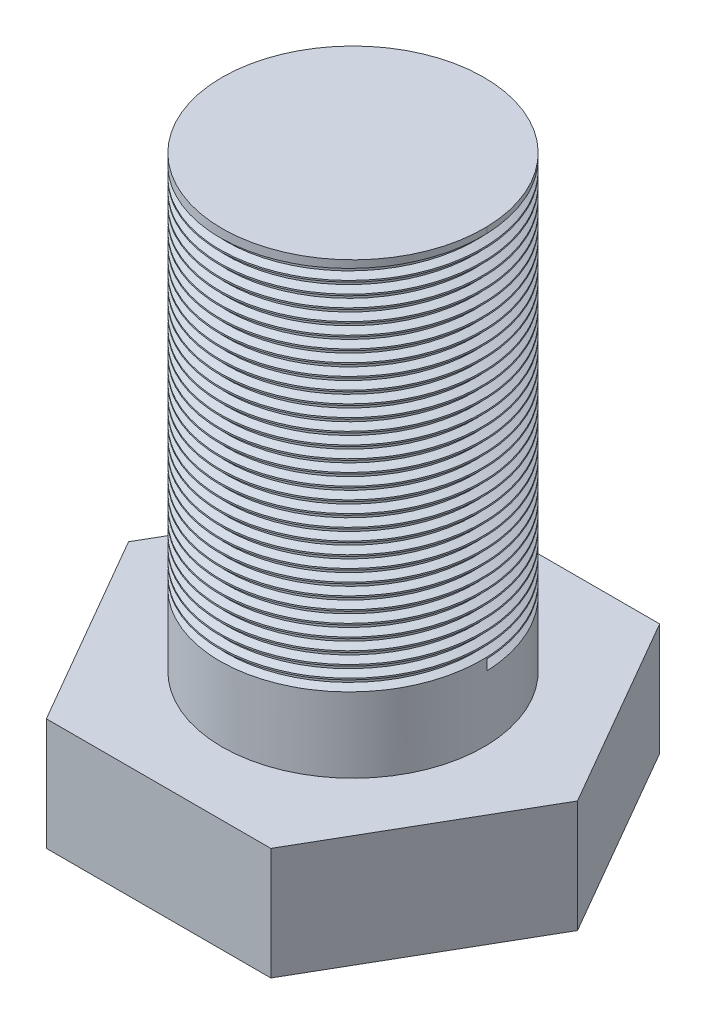
from build123d import *

# Parameters (mm, degrees)
BOSS_EXTRUDE1_DEPTH = 3
SKETCH2_R           = 3.5
BOSS_EXTRUDE2_DEPTH = 12
THREAD1_PITCH       = 0.3175


with BuildPart() as part:
    # Sketch1 → Boss-Extrude1 (new body)
    with BuildSketch(Plane(origin=(0, 0, 0), x_dir=(1, 0, 0), z_dir=(0, 1, 0))):
        Polygon((3, -5.196152423), (6, 0), (3, 5.196152423), (-3, 5.196152423), (-6, 0), (-3, -5.196152423), align=None)
    extrude(amount=BOSS_EXTRUDE1_DEPTH)

    # Sketch2 → Boss-Extrude2 (add)
    with BuildSketch(Plane(origin=(0, 3, 0), x_dir=(1, 0, 0), z_dir=(0, 1, 0))):
        with Locations(Location((0, 0, 0), (0, 0, 270))):
            Circle(SKETCH2_R)
    extrude(amount=BOSS_EXTRUDE2_DEPTH)

    # Thread1: the profile of Thread Profile1 profile screwed along a right-hand helix of 31.496063 turns, 6 arcs to a turn; built about Z, then put on its axis
    thread1_z = Axis((0, 0, 0), (0, 0, 1))
    thread1_corners = [(3.5003, 0, -0.000173205), (3.5003, 0, 0.277985704), (3.328148085, 0, 0.17859375), (3.328148085, 0, 0.09921875)]
    with BuildLine(mode=Mode.PRIVATE) as thread1_profile:
        Line(thread1_corners[0], thread1_corners[1])
        Line(thread1_corners[1], thread1_corners[2])
        Line(thread1_corners[2], thread1_corners[3])
        Line(thread1_corners[3], thread1_corners[0])
    thread1_cap = Face(thread1_profile.wire())
    thread1_turn_angles = [0, 30, 60, 90, 120, 150, 180, 210, 240, 270, 300, 330, 360]
    thread1_turn_weights = [1, 0.8660254037844387, 1, 0.8660254037844387, 1, 0.8660254037844387, 1, 0.8660254037844387, 1, 0.8660254037844387, 1, 0.8660254037844387, 1]
    thread1_turn_rails = [Edge.make_bspline([Vector(p[0], p[1], 0).rotate(thread1_z, thread1_turn_angles[k]) / thread1_turn_weights[k] + Vector(0, 0, p[2] + THREAD1_PITCH * thread1_turn_angles[k] / 360) for k in range(13)], [0, 0, 0, 1, 1, 2, 2, 3, 3, 4, 4, 5, 5, 6, 6, 6], 2, thread1_turn_weights) for p in thread1_corners]
    thread1_turn_sides = [Face.make_surface_from_curves(thread1_turn_rails[p[0]], thread1_turn_rails[p[1]]) for p in [(0, 1), (1, 2), (2, 3), (3, 0)]]
    thread1_last_angles = [11160, 11190, 11220, 11250, 11280, 11309.291338583, 11338.582677165]
    thread1_last_weights = [1, 0.8660254037844387, 1, 0.8660254037844387, 1, 0.872143242535045, 1]
    thread1_last_rails = [Edge.make_bspline([Vector(p[0], p[1], 0).rotate(thread1_z, thread1_last_angles[k]) / thread1_last_weights[k] + Vector(0, 0, p[2] + THREAD1_PITCH * thread1_last_angles[k] / 360) for k in range(7)], [0, 0, 0, 1, 1, 2, 2, 3, 3, 3], 2, thread1_last_weights) for p in thread1_corners]
    thread1_last_sides = [Face.make_surface_from_curves(thread1_last_rails[p[0]], thread1_last_rails[p[1]]) for p in [(0, 1), (1, 2), (2, 3), (3, 0)]]
    thread1 = Plane(origin=(0, 15, 0), x_dir=(-1, 0, 0), z_dir=(0, -1, 0)) * Solid(Shell([*[p.moved(Location((0, 0, THREAD1_PITCH * i))) for i in range(31) for p in thread1_turn_sides], *thread1_last_sides, thread1_cap, thread1_cap.rotate(thread1_z, 11338.582677165).moved(Location((0, 0, THREAD1_PITCH * 11338.582677165 / 360)))]))
    add(thread1, mode=Mode.SUBTRACT)


solid = part.part
